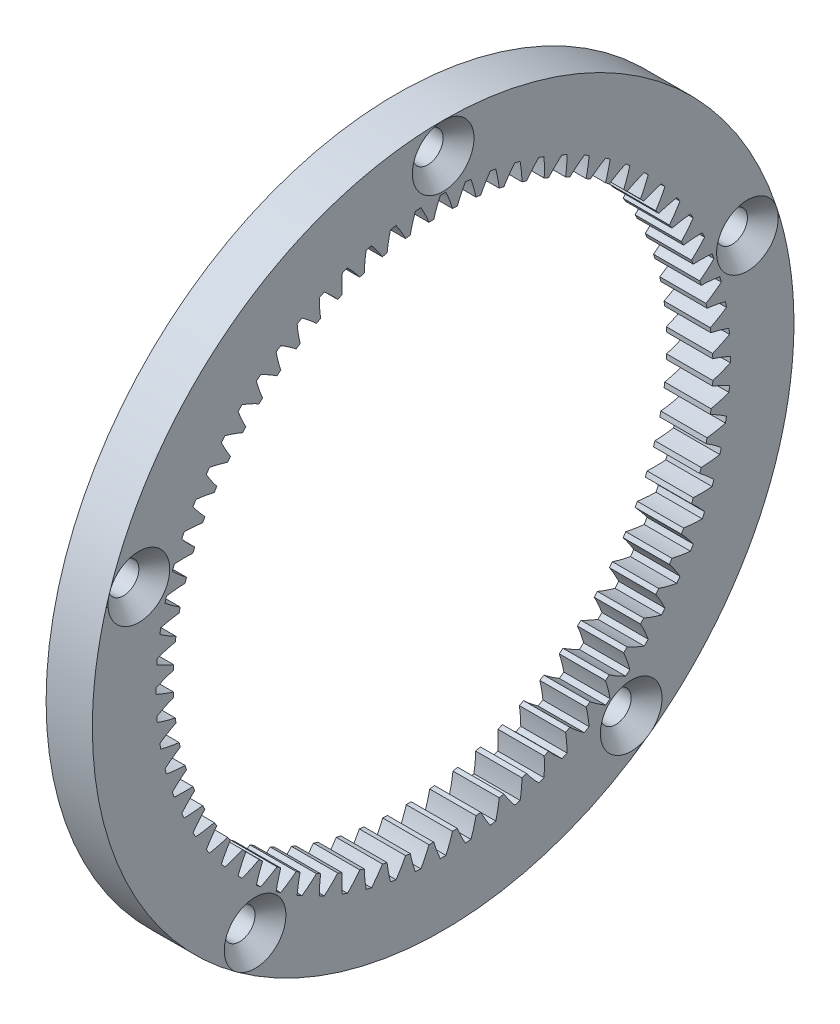
from build123d import *

# Parameters (mm, degrees)
BASPROSKE_W                  = 3
BASPROSKE_H                  = 5.25
TOOTHCUT_DEPTH               = 33.312923111
TEETHCUTS_COUNT              = 72
CUT_EXTRUDE1_REACH           = 34.313
SKETCH1_R                    = 1
CHAMFER1_SIZE                = 1
CIRPATTERN1_COUNT            = 5
CHAMFER1_OF_CIRPATTERN1_SIZE = 1


with BuildPart() as part:
    # BasProSke → Base-Revolve (revolve)
    with BuildSketch(Plane(origin=(0, 0, 0), x_dir=(1, 0, 0), z_dir=(0, 1, 0)), mode=Mode.PRIVATE) as base_revolve_sk:
        with Locations((1.5, 20.125)):
            Rectangle(BASPROSKE_W, BASPROSKE_H)
    revolve(base_revolve_sk.sketch.rotate(Axis((-10, 0, 0), (1, 0, 0)), 180), axis=Axis((-10, 0, 0), (1, 0, 0)))

    # TooCutSke → ToothCut (cut, through all)
    with BuildSketch(Plane(origin=(0, 0, 0), x_dir=(0, 0, -1), z_dir=(1, 0, 0))):
        with BuildLine():
            ThreePointArc((0.616898898, 17.463707536), (0.418864032, 18.051939155), (0.180757644, 18.62512289))
            ThreePointArc((0.180757644, 18.62512289), (0, 18.626), (-0.180757644, 18.62512289))
            ThreePointArc((-0.180757644, 18.62512289), (-0.418864032, 18.051939155), (-0.616898898, 17.463707536))
            ThreePointArc((-0.616898898, 17.463707536), (0, 17.4746), (0.616898898, 17.463707536))
        make_face()
    toothcut = extrude(amount=TOOTHCUT_DEPTH, mode=Mode.SUBTRACT)

    # TeethCuts: ToothCut ×72 about axis
    teethcuts_axis = Axis((0, 0, 0), (1, 0, 0))
    for i in range(1, TEETHCUTS_COUNT):
        add(toothcut.rotate(teethcuts_axis, i * 360 / TEETHCUTS_COUNT), mode=Mode.SUBTRACT)

    # Sketch1 → Cut-Extrude1 (cut, up to next)
    with BuildSketch(Plane(origin=(3, 0, 0), x_dir=(0, 0, -1), z_dir=(1, 0, 0)), mode=Mode.PRIVATE) as cut_extrude1_sk1:
        with Locations((0, 20.75)):
            Circle(SKETCH1_R)
    cut_extrude1_tool1 = extrude(cut_extrude1_sk1.sketch, amount=-CUT_EXTRUDE1_REACH, mode=Mode.PRIVATE) & part.part
    cut_extrude1 = cut_extrude1_tool1.solids().sort_by_distance((3, 20.75, 0))[0]
    add(cut_extrude1, mode=Mode.SUBTRACT)

    # Chamfer1
    chamfer1_edges = [part.edges().sort_by_distance(p)[0] for p in [
        (3, 20.75, 1),
    ]]
    chamfer(chamfer1_edges, length=CHAMFER1_SIZE - 0.0001)  # a hair under: the kernel refuses the full size

    # CirPattern1: Cut-Extrude1 ×5 about axis
    cirpattern1_axis = Axis((0, 0, 0), (1, 0, 0))
    for i in range(1, CIRPATTERN1_COUNT):
        add(cut_extrude1.rotate(cirpattern1_axis, i * 360 / CIRPATTERN1_COUNT), mode=Mode.SUBTRACT)

    # Chamfer1 of CirPattern1
    chamfer1_of_cirpattern1_edges = [part.edges().sort_by_distance(p)[0] for p in [
        (3, 5.461046117, 20.043439707),
        (3, -17.374887886, 11.387526991),
        (3, -16.199317381, -13.005560979),
        (3, 7.36315915, -19.425405719),
    ]]
    chamfer(chamfer1_of_cirpattern1_edges, length=CHAMFER1_OF_CIRPATTERN1_SIZE - 0.0001)  # a hair under: the kernel refuses the full size


solid = part.part
